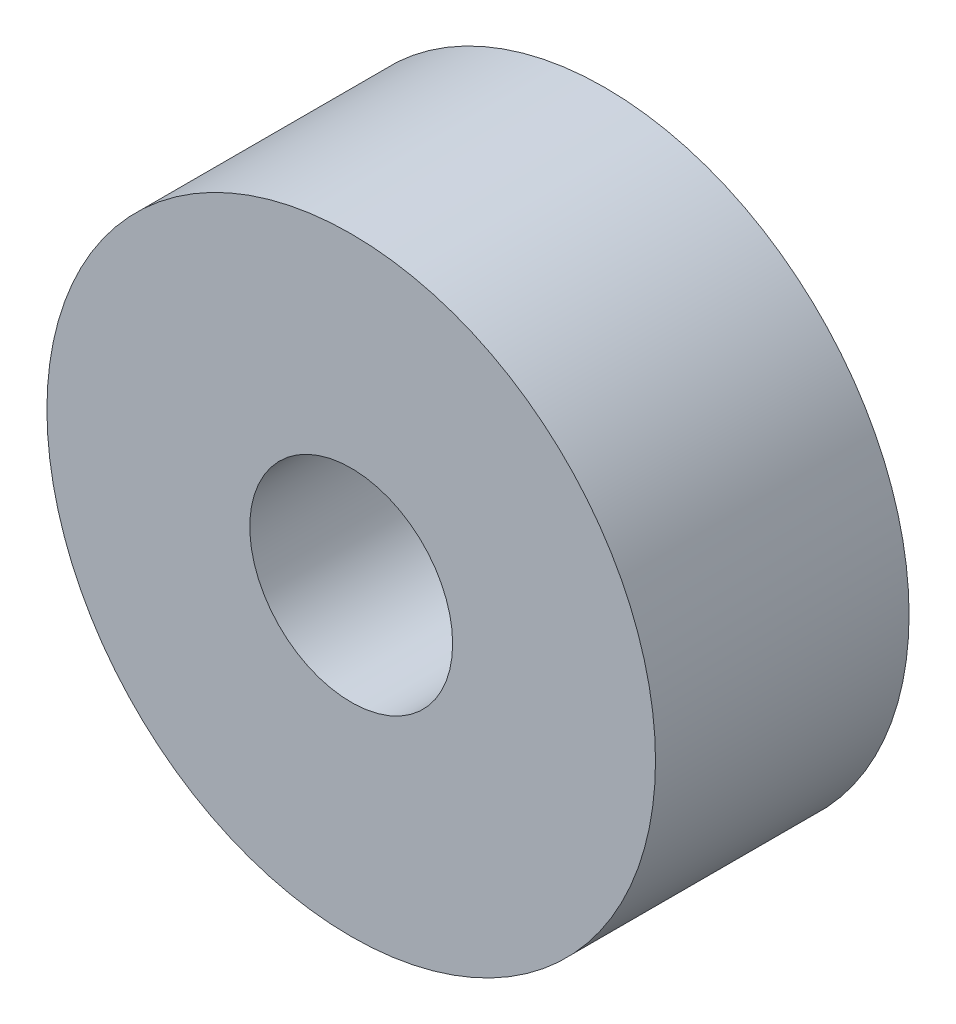
from build123d import *

# Parameters (mm, degrees)
SKETCH1_R                        = 9.525
SKETCH1_R_2                      = 3.175
BOSS_EXTRUDE1_DEPTH              = 7.9375
TAP_DRILL_FOR_6_32_TAP1_D        = 2.7051
TAP_DRILL_FOR_6_32_TAP1_DEPTH    = 6.35
TAP_DRILL_FOR_6_32_TAP1_TIP      = 0.81269403
F_1_8_0_125_DIAMETER_HOLE1_D     = 3.175
F_1_8_0_125_DIAMETER_HOLE1_DEPTH = 6.35
F_1_8_0_125_DIAMETER_HOLE1_TIP   = 0.953866233


with BuildPart() as part:
    # Sketch1 → Boss-Extrude1 (new body)
    with BuildSketch(Plane.XY):
        Circle(SKETCH1_R)
        Circle(SKETCH1_R_2, mode=Mode.SUBTRACT)
    extrude(amount=BOSS_EXTRUDE1_DEPTH)

    # Tap Drill for #6-32 Tap1
    with Locations(Plane(origin=(0, 0, 0), x_dir=(-1, 0, 0), z_dir=(0, 0, -1))):
        with Locations((6.35, 0), (-6.35, 0)):
            Hole(TAP_DRILL_FOR_6_32_TAP1_D / 2, depth=TAP_DRILL_FOR_6_32_TAP1_DEPTH)
            with Locations((0, 0, -(TAP_DRILL_FOR_6_32_TAP1_DEPTH + TAP_DRILL_FOR_6_32_TAP1_TIP / 2))):  # 118° drill point
                Cone(0, TAP_DRILL_FOR_6_32_TAP1_D / 2, TAP_DRILL_FOR_6_32_TAP1_TIP, mode=Mode.SUBTRACT)

    # 1/8 (0.125) Diameter Hole1
    with Locations(Plane(origin=(0, 0, 0), x_dir=(-1, 0, 0), z_dir=(0, 0, -1))):
        with Locations((0, -6.35), (0, 6.35)):
            Hole(F_1_8_0_125_DIAMETER_HOLE1_D / 2, depth=F_1_8_0_125_DIAMETER_HOLE1_DEPTH)
            with Locations((0, 0, -(F_1_8_0_125_DIAMETER_HOLE1_DEPTH + F_1_8_0_125_DIAMETER_HOLE1_TIP / 2))):  # 118° drill point
                Cone(0, F_1_8_0_125_DIAMETER_HOLE1_D / 2, F_1_8_0_125_DIAMETER_HOLE1_TIP, mode=Mode.SUBTRACT)


solid = part.part
